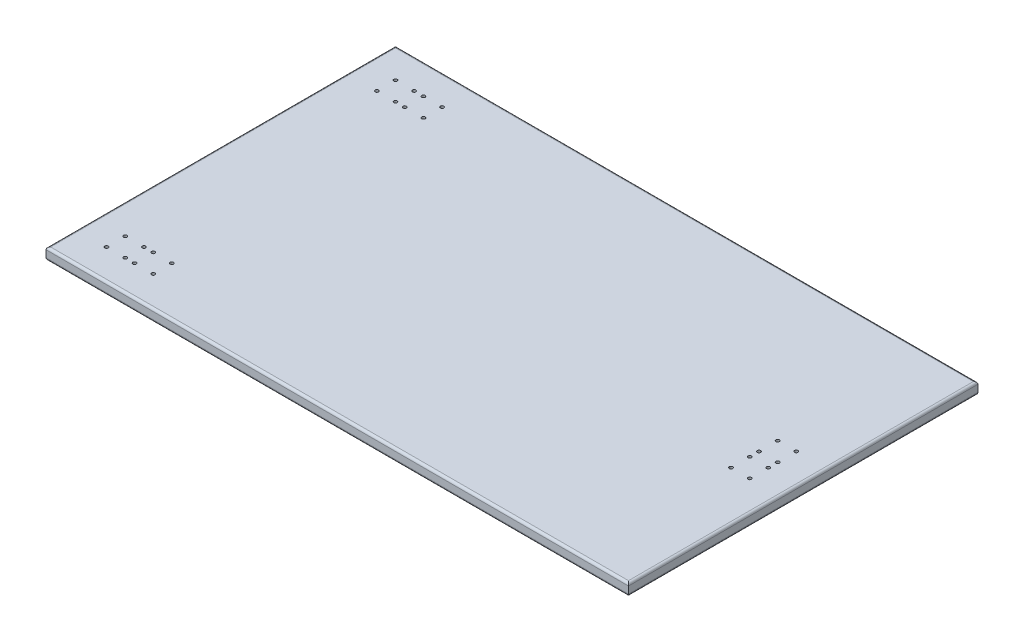
from build123d import *

# Parameters (mm, degrees)
ESQUISSE1_W             = 2500
ESQUISSE1_H             = 1500
BOSS_EXTRU_1_DEPTH      = 50
CONG_1_R                = 10
CONG_2_R                = 10
ESQUISSE4_R             = 7.25
ENL_V_MAT_EXTRU_2_DEPTH = 1459.595214581
ESQUISSE5_R             = 7.25
ENL_V_MAT_EXTRU_3_DEPTH = 1459.595214581


with BuildPart() as part:
    # Esquisse1 → Boss.-Extru.1 (new body)
    with BuildSketch(Plane(origin=(0, 0, 0), x_dir=(1, 0, 0), z_dir=(0, 1, 0))):
        Rectangle(ESQUISSE1_W, ESQUISSE1_H)
    extrude(amount=BOSS_EXTRU_1_DEPTH)

    # Congé1
    cong_1_edges = [part.edges().sort_by_distance(p)[0] for p in [
        (0, 50, -750),
        (1250, 50, 0),
        (0, 50, 750),
        (-1250, 50, 0),
    ]]
    fillet(cong_1_edges, radius=CONG_1_R)

    # Congé2
    cong_2_edges = [part.edges().sort_by_distance(p)[0] for p in [
        (0, 0, 750),
        (1250, 0, 0),
        (0, 0, -750),
        (-1250, 0, 0),
    ]]
    fillet(cong_2_edges, radius=CONG_2_R)

    # Esquisse4 → Enlèv. mat.-Extru.2 (cut, through all)
    with BuildSketch(Plane.XZ):
        with Locations((1120, -100)):
            Circle(ESQUISSE4_R)
        with Locations((1040, -100)):
            Circle(ESQUISSE4_R)
        with Locations((1040, -20)):
            Circle(ESQUISSE4_R)
        with Locations((1120, -20)):
            Circle(ESQUISSE4_R)
        with Locations((1120, 100)):
            Circle(ESQUISSE4_R)
        with Locations((1120, 20)):
            Circle(ESQUISSE4_R)
        with Locations((1040, 20)):
            Circle(ESQUISSE4_R)
        with Locations((1040, 100)):
            Circle(ESQUISSE4_R)
    extrude(amount=-ENL_V_MAT_EXTRU_2_DEPTH, mode=Mode.SUBTRACT)

    # Esquisse5 → Enlèv. mat.-Extru.3 (cut, through all)
    with BuildSketch(Plane(origin=(0, 0, 0), x_dir=(-1, 0, 0), z_dir=(0, -1, 0))):
        with Locations((1120, 620)):
            Circle(ESQUISSE5_R)
        with Locations((1040, 620)):
            Circle(ESQUISSE5_R)
        with Locations((1040, 540)):
            Circle(ESQUISSE5_R)
        with Locations((1120, 540)):
            Circle(ESQUISSE5_R)
        with Locations((920, 620)):
            Circle(ESQUISSE5_R)
        with Locations((1000, 620)):
            Circle(ESQUISSE5_R)
        with Locations((1000, 540)):
            Circle(ESQUISSE5_R)
        with Locations((920, 540)):
            Circle(ESQUISSE5_R)
        with Locations((920, -620)):
            Circle(ESQUISSE5_R)
        with Locations((920, -540)):
            Circle(ESQUISSE5_R)
        with Locations((1000, -540)):
            Circle(ESQUISSE5_R)
        with Locations((1000, -620)):
            Circle(ESQUISSE5_R)
        with Locations((1040, -620)):
            Circle(ESQUISSE5_R)
        with Locations((1040, -540)):
            Circle(ESQUISSE5_R)
        with Locations((1120, -540)):
            Circle(ESQUISSE5_R)
        with Locations((1120, -620)):
            Circle(ESQUISSE5_R)
    extrude(amount=-ENL_V_MAT_EXTRU_3_DEPTH, mode=Mode.SUBTRACT)


solid = part.part
